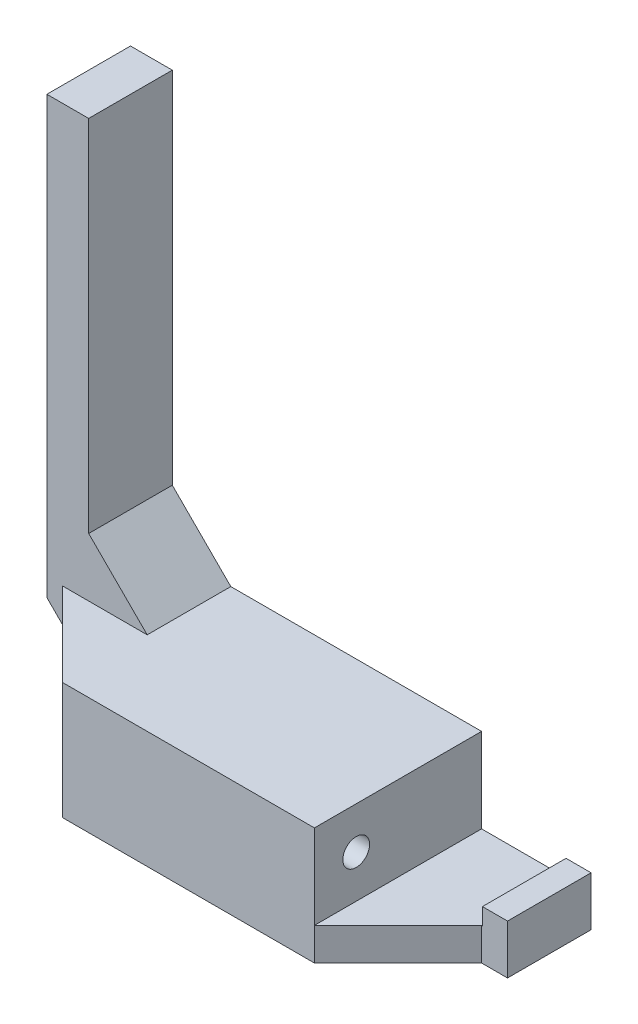
from build123d import *

# Parameters (mm, degrees)
EXTRUDE_1_DEPTH     = 10
SKETCH_2_W          = 30.142135624
SKETCH_2_H          = 14
EXTRUDE_2_DEPTH     = 10
CHAMFER_2_SIZE      = 10
SKETCH_3_R          = 1.6
CUT_EXTRUDE_1_DEPTH = 77.000065789
SKETCH_4_R          = 3
CUT_EXTRUDE_2_DEPTH = 23


with BuildPart() as part:
    # ｽｹｯﾁ1 → ﾎﾞｽ - 押し出し1 (new body)
    with BuildSketch(Plane.XY):
        Polygon((0, 0), (0, 10.1), (-30, 10.1), (-37, 17.1), (-37, 60.1), (-42, 60.1), (-42, 7.957864376), (-30.142135624, -3.9), (13.1, -3.9), (13.1, 2), (10.1, 2), (10.1, 0), align=None)
    extrude(amount=EXTRUDE_1_DEPTH)

    # ｽｹｯﾁ2 → ﾎﾞｽ - 押し出し2 (add)
    with BuildSketch(Plane.XY.offset(10)):
        with Locations((-15.071067812, 3.1)):
            Rectangle(SKETCH_2_W, SKETCH_2_H)
    extrude(amount=EXTRUDE_2_DEPTH)

    # 面取り2
    chamfer_2_edges = [part.edges().sort_by_distance(p)[0] for p in [
        (-30.142135624, 3.1, 10),
        (0, -1.95, 10),
    ]]
    chamfer(chamfer_2_edges, length=CHAMFER_2_SIZE - 0.0001)  # a hair under: the kernel refuses the full size

    # ｽｹｯﾁ3 → ｶｯﾄ - 押し出し1 (cut, through all)
    with BuildSketch(Plane(origin=(0, 0, 0), x_dir=(0, 0, -1), z_dir=(1, 0, 0))):
        with Locations((-15, 5.1)):
            Circle(SKETCH_3_R)
    extrude(amount=-CUT_EXTRUDE_1_DEPTH, mode=Mode.SUBTRACT)

    # ｽｹｯﾁ4 → ｶｯﾄ - 押し出し2 (cut)
    with BuildSketch(Plane.ZY.offset(42)):
        with Locations(Location((15, 5.1, 0), (0, 0, 270))):
            Circle(SKETCH_4_R)
    extrude(amount=-CUT_EXTRUDE_2_DEPTH, mode=Mode.SUBTRACT)


solid = part.part
